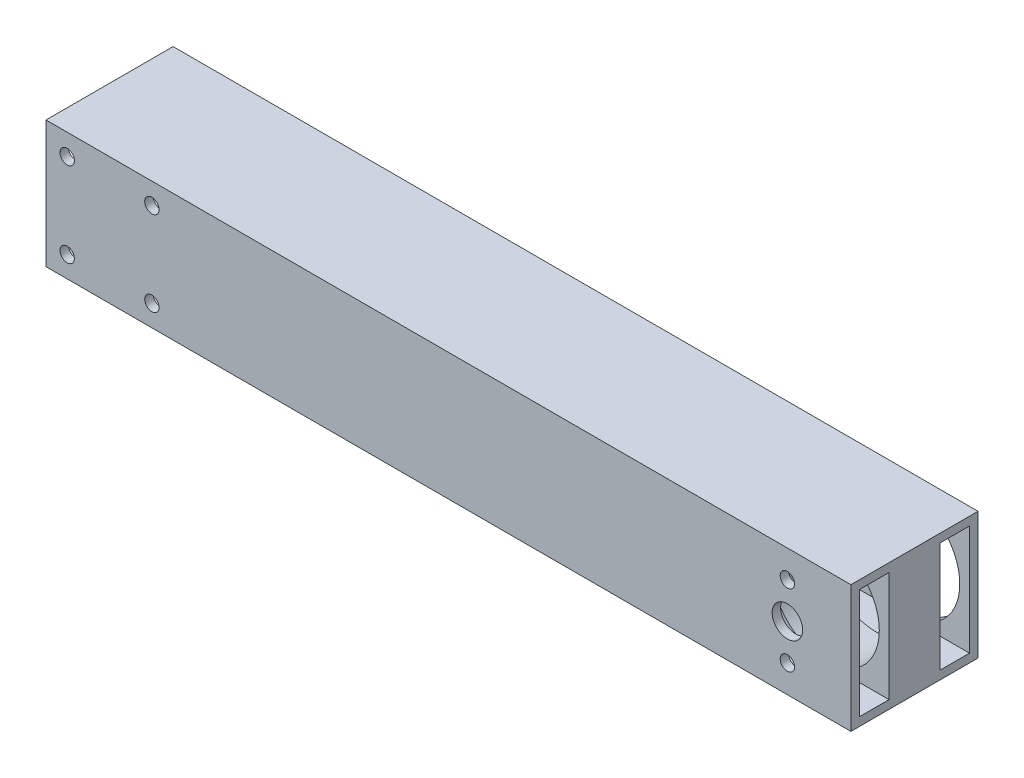
from build123d import *

# Parameters (mm, degrees)
BOSS_EXTRUDE3_DEPTH      = 110
BOSS_EXTRUDE3_DEPTH_BACK = 80
SKETCH1_W                = 30
SKETCH1_H                = 30
SKETCH1_W_2              = 7
SKETCH1_H_2              = 26
SKETCH6_R                = 12.7
CUT_EXTRUDE5_DEPTH       = 23
SKETCH8_R                = 3.6
SKETCH8_R_2              = 1.7
CUT_EXTRUDE6_DEPTH       = 17
SKETCH9_W                = 12
SKETCH9_H                = 26
CUT_EXTRUDE7_DEPTH       = 155
M3_CLEARANCE_HOLE1_D     = 3.4


with BuildPart() as part:
    # Sketch1 → Boss-Extrude3 (new, two sides: drawn at the far end of the back side and taken through both)
    with BuildSketch(Plane(origin=(0, 0, 0), x_dir=(0, 0, -1), z_dir=(1, 0, 0)).offset(-BOSS_EXTRUDE3_DEPTH_BACK)):
        Rectangle(SKETCH1_W, SKETCH1_H)
        with Locations((-9.5, 0)):
            Rectangle(SKETCH1_W_2, SKETCH1_H_2, mode=Mode.SUBTRACT)
        with Locations((9.5, 0)):
            Rectangle(SKETCH1_W_2, SKETCH1_H_2, mode=Mode.SUBTRACT)
    extrude(amount=BOSS_EXTRUDE3_DEPTH + BOSS_EXTRUDE3_DEPTH_BACK)

    # Sketch6 → Cut-Extrude5 (cut)
    with BuildSketch(Plane(origin=(0, 0, -15), x_dir=(-1, 0, 0), z_dir=(0, 0, -1))):
        with Locations((-95, 0)):
            Circle(SKETCH6_R)
    extrude(amount=-CUT_EXTRUDE5_DEPTH, mode=Mode.SUBTRACT)

    # Sketch8 → Cut-Extrude6 (cut)
    with BuildSketch(Plane.XY.offset(15)):
        with Locations((95, 0)):
            Circle(SKETCH8_R)
        with Locations((95, 8.5)):
            Circle(SKETCH8_R_2)
        with Locations((95, -8.5)):
            Circle(SKETCH8_R_2)
    extrude(amount=-CUT_EXTRUDE6_DEPTH, mode=Mode.SUBTRACT)

    # Sketch9 → Cut-Extrude7 (cut)
    with BuildSketch(Plane.ZY.offset(80)):
        Rectangle(SKETCH9_W, SKETCH9_H)
    extrude(amount=-CUT_EXTRUDE7_DEPTH, mode=Mode.SUBTRACT)

    # M3 Clearance Hole1 (through all)
    with Locations(Plane.XY.offset(15)):
        with Locations((-75, 10), (-75, -10), (-55, -10), (-55, 10)):
            Hole(M3_CLEARANCE_HOLE1_D / 2)


solid = part.part
